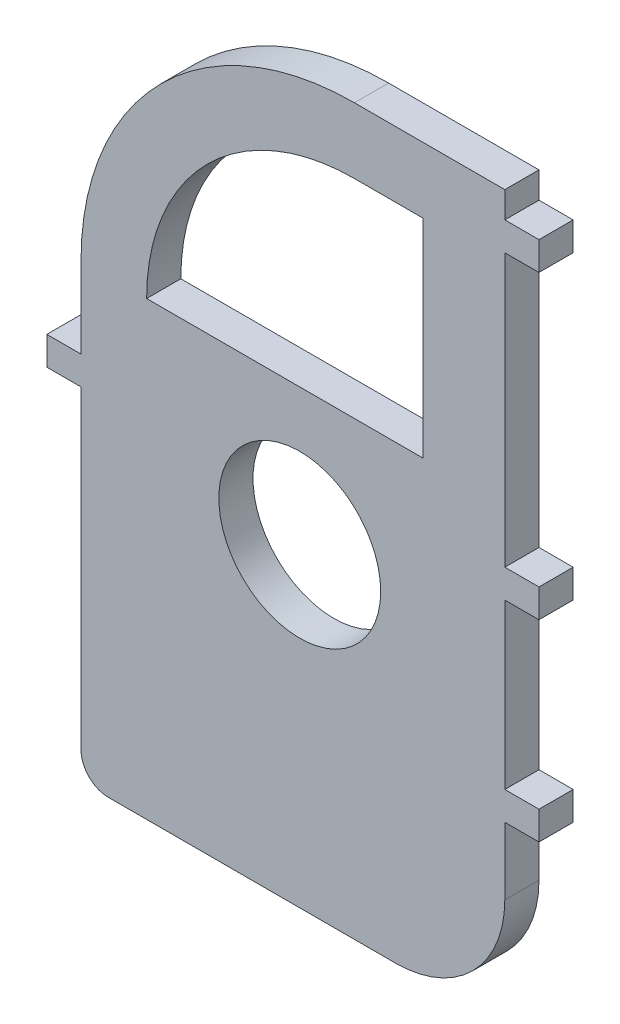
from build123d import *

# Parameters (mm, degrees)
SKETCH1_R              = 3.7592
BOSS_EXTRUDE1_DEPTH    = 1.5875
FILLET1_R              = 5.08
FILLET2_R              = 1.27
WEIGHT_REDUCTION_REACH = 24.437


with BuildPart() as part:
    # Sketch1 → Boss-Extrude1 (new body)
    with BuildSketch(Plane.XY):
        with BuildLine():
            Line((11.1125, 17.8308), (9.525, 17.8308))
            Line((9.525, 17.8308), (9.525, 19.05))
            Line((9.525, 19.05), (2.54, 19.05))
            ThreePointArc((2.54, 19.05), (-6.440256121, 15.330256121), (-10.16, 6.35))
            Line((-10.16, 6.35), (-10.16, 2.5908))
            Line((-10.16, 2.5908), (-11.7475, 2.5908))
            Line((-11.7475, 2.5908), (-11.7475, 1.27))
            Line((-11.7475, 1.27), (-10.16, 1.27))
            Line((-10.16, 1.27), (-10.16, -14.605))
            Line((-10.16, -14.605), (9.525, -14.605))
            Line((9.525, -14.605), (9.525, -6.4008))
            Line((9.525, -6.4008), (11.1125, -6.4008))
            Line((11.1125, -6.4008), (11.1125, -5.08))
            Line((11.1125, -5.08), (9.525, -5.08))
            Line((9.525, -5.08), (9.525, 2.54))
            Line((9.525, 2.54), (11.1125, 2.54))
            Line((11.1125, 2.54), (11.1125, 3.8608))
            Line((11.1125, 3.8608), (9.525, 3.8608))
            Line((9.525, 3.8608), (9.525, 16.51))
            Line((9.525, 16.51), (11.1125, 16.51))
            Line((11.1125, 16.51), (11.1125, 17.8308))
        make_face()
        Circle(SKETCH1_R, mode=Mode.SUBTRACT)
    extrude(amount=BOSS_EXTRUDE1_DEPTH)

    # Fillet1
    fillet1_edges = [part.edges().sort_by_distance(p)[0] for p in [
        (9.525, -14.605, 0.79375),
    ]]
    fillet(fillet1_edges, radius=FILLET1_R)

    # Fillet2
    fillet2_edges = [part.edges().sort_by_distance(p)[0] for p in [
        (-10.16, -14.605, 0.79375),
    ]]
    fillet(fillet2_edges, radius=FILLET2_R)

    # Sketch2 → Weight Reduction (cut, up to next)
    with BuildSketch(Plane.XY.offset(1.5875), mode=Mode.PRIVATE) as weight_reduction_sk1:
        with BuildLine():
            Line((-7.112, 6.35), (5.715, 6.35))
            Line((5.715, 6.35), (5.715, 16.002))
            Line((5.715, 16.002), (2.54, 16.002))
            ThreePointArc((2.54, 16.002), (-4.284994652, 13.174994652), (-7.112, 6.35))
        make_face()
    weight_reduction_tool1 = extrude(weight_reduction_sk1.sketch, amount=-WEIGHT_REDUCTION_REACH, mode=Mode.PRIVATE) & part.part
    add(weight_reduction_tool1.solids().sort_by_distance((0.121424, 10.661798, 1.5875))[0], mode=Mode.SUBTRACT)


solid = part.part
